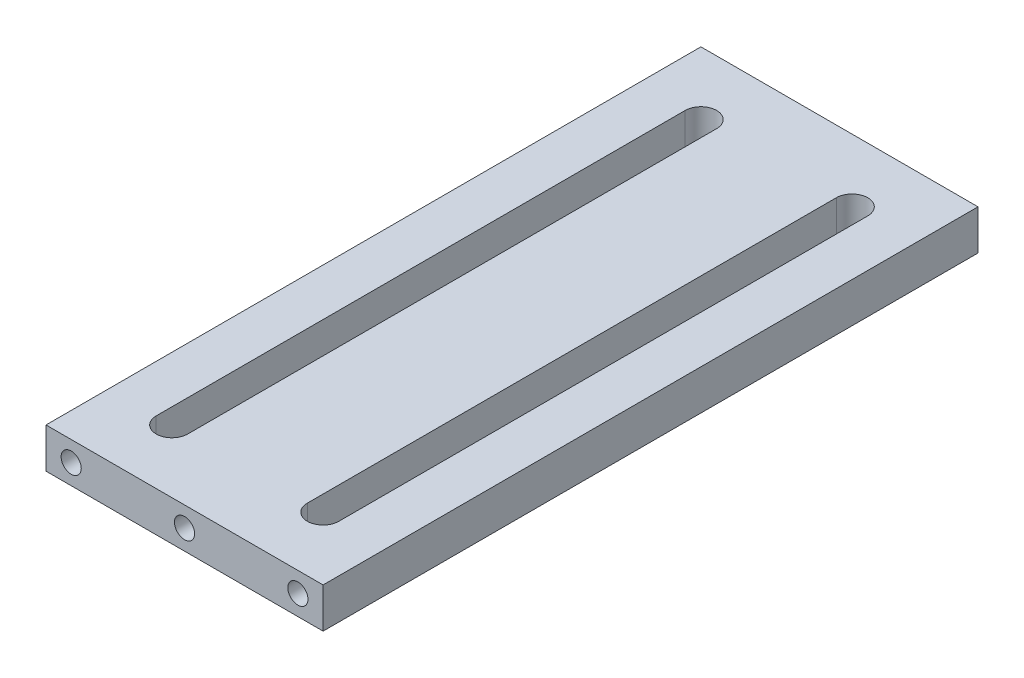
from build123d import *

# Parameters (mm, degrees)
SKETCH1_W           = 22
SKETCH1_H           = 52
BOSS_EXTRUDE1_DEPTH = 3.18
CUT_EXTRUDE1_DEPTH  = 57.551855849
SKETCH3_R           = 0.8
CUT_EXTRUDE2_DEPTH  = 4


with BuildPart() as part:
    # Sketch1 → Boss-Extrude1 (new body)
    with BuildSketch(Plane(origin=(0, 0, 0), x_dir=(1, 0, 0), z_dir=(0, 1, 0))):
        with Locations((11, 26)):
            Rectangle(SKETCH1_W, SKETCH1_H)
    extrude(amount=BOSS_EXTRUDE1_DEPTH)

    # Sketch2 → Cut-Extrude1 (cut, through all)
    with BuildSketch(Plane(origin=(0, 3.18, 0), x_dir=(1, 0, 0), z_dir=(0, 1, 0))):
        with BuildLine():
            Line((3.75, 5), (3.75, 47))
            ThreePointArc((3.75, 47), (5, 48.25), (6.25, 47))
            Line((6.25, 47), (6.25, 5))
            ThreePointArc((6.25, 5), (5, 3.75), (3.75, 5))
        make_face()
    cut_extrude1 = extrude(amount=-CUT_EXTRUDE1_DEPTH, mode=Mode.SUBTRACT)

    # Mirror1: Cut-Extrude1 across plane
    add(cut_extrude1.mirror(Plane(origin=(11, 0, 0), x_dir=(0, 0, 1), z_dir=(1, 0, 0))), mode=Mode.SUBTRACT)

    # Sketch3 → Cut-Extrude2 (cut)
    with BuildSketch(Plane.XY):
        with Locations((11, 1.59)):
            Circle(SKETCH3_R)
        with Locations((2, 1.59)):
            Circle(SKETCH3_R)
        with Locations((20, 1.59)):
            Circle(SKETCH3_R)
    extrude(amount=-CUT_EXTRUDE2_DEPTH, mode=Mode.SUBTRACT)


solid = part.part
